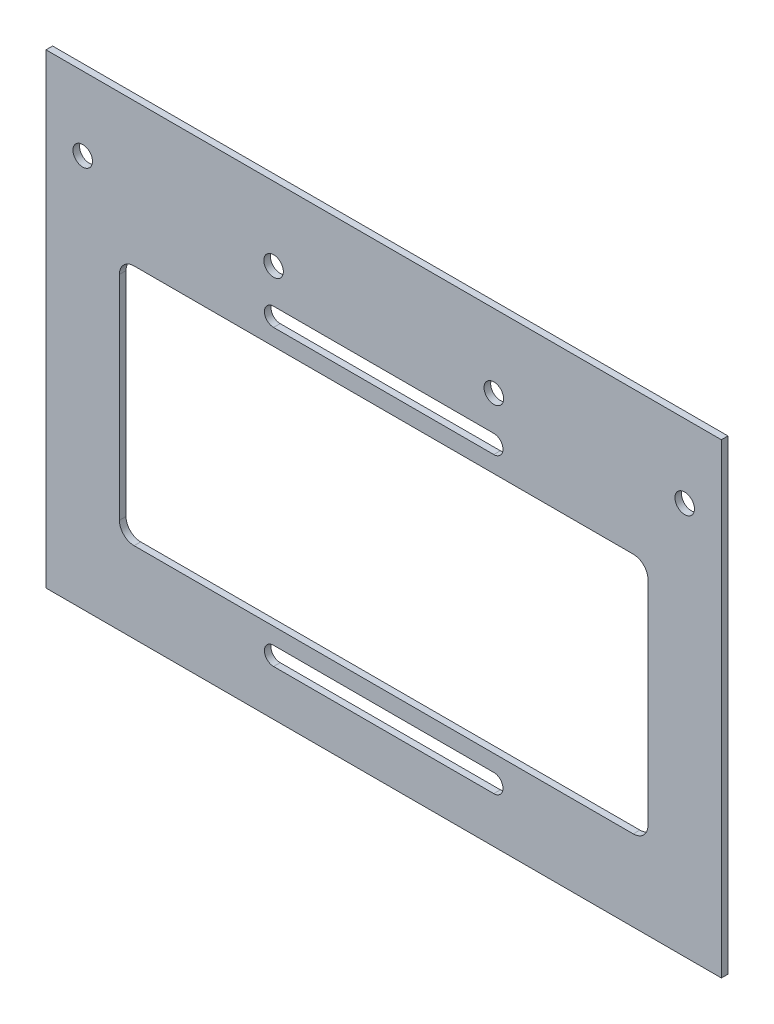
from build123d import *

# Parameters (mm, degrees)
SKETCH1_W               = 233.68
SKETCH1_H               = 161.29
BOSS_EXTRUDE1_DEPTH     = 2.286
CUT_EXTRUDE1_DEPTH      = 142.987419939
F_1_4_CLEARANCE_HOLE1_D = 6.7564
F_1_4_CLEARANCE_HOLE2_D = 6.7564


with BuildPart() as part:
    # Sketch1 → Boss-Extrude1 (new body)
    with BuildSketch(Plane.XY):
        Rectangle(SKETCH1_W, SKETCH1_H)
        with BuildLine():
            Line((-86.36, 31.115), (86.36, 31.115))
            ThreePointArc((86.36, 31.115), (89.952102448, 29.627102448), (91.44, 26.035))
            Line((91.44, 26.035), (91.44, -47.625))
            ThreePointArc((91.44, -47.625), (89.952102448, -51.217102448), (86.36, -52.705))
            Line((86.36, -52.705), (-86.36, -52.705))
            ThreePointArc((-86.36, -52.705), (-89.952102448, -51.217102448), (-91.44, -47.625))
            Line((-91.44, -47.625), (-91.44, 26.035))
            ThreePointArc((-91.44, 26.035), (-89.952102448, 29.627102448), (-86.36, 31.115))
        make_face(mode=Mode.SUBTRACT)
    extrude(amount=BOSS_EXTRUDE1_DEPTH)

    # Sketch2 → Cut-Extrude1 (cut, through all)
    with BuildSketch(Plane.XY.offset(2.286)):
        with BuildLine():
            Line((38.1, 36.83), (-38.1, 36.83))
            ThreePointArc((-38.1, 36.83), (-41.275, 40.005), (-38.1, 43.18))
            Line((-38.1, 43.18), (38.1, 43.18))
            ThreePointArc((38.1, 43.18), (41.275, 40.005), (38.1, 36.83))
        make_face()
        with BuildLine():
            Line((38.1, -58.42), (-38.1, -58.42))
            ThreePointArc((-38.1, -58.42), (-41.275, -61.595), (-38.1, -64.77))
            Line((-38.1, -64.77), (38.1, -64.77))
            ThreePointArc((38.1, -64.77), (41.275, -61.595), (38.1, -58.42))
        make_face()
    extrude(amount=-CUT_EXTRUDE1_DEPTH, mode=Mode.SUBTRACT)

    # 1/4 Clearance Hole1 (through all)
    with Locations(Plane.XY.offset(2.286)):
        with Locations((-38.1, 55.245), (38.1, 55.245)):
            Hole(F_1_4_CLEARANCE_HOLE1_D / 2)

    # 1/4 Clearance Hole2 (through all)
    with Locations(Plane.XY.offset(2.286)):
        with Locations((-104.14, 55.245), (104.14, 55.245)):
            Hole(F_1_4_CLEARANCE_HOLE2_D / 2)


solid = part.part
